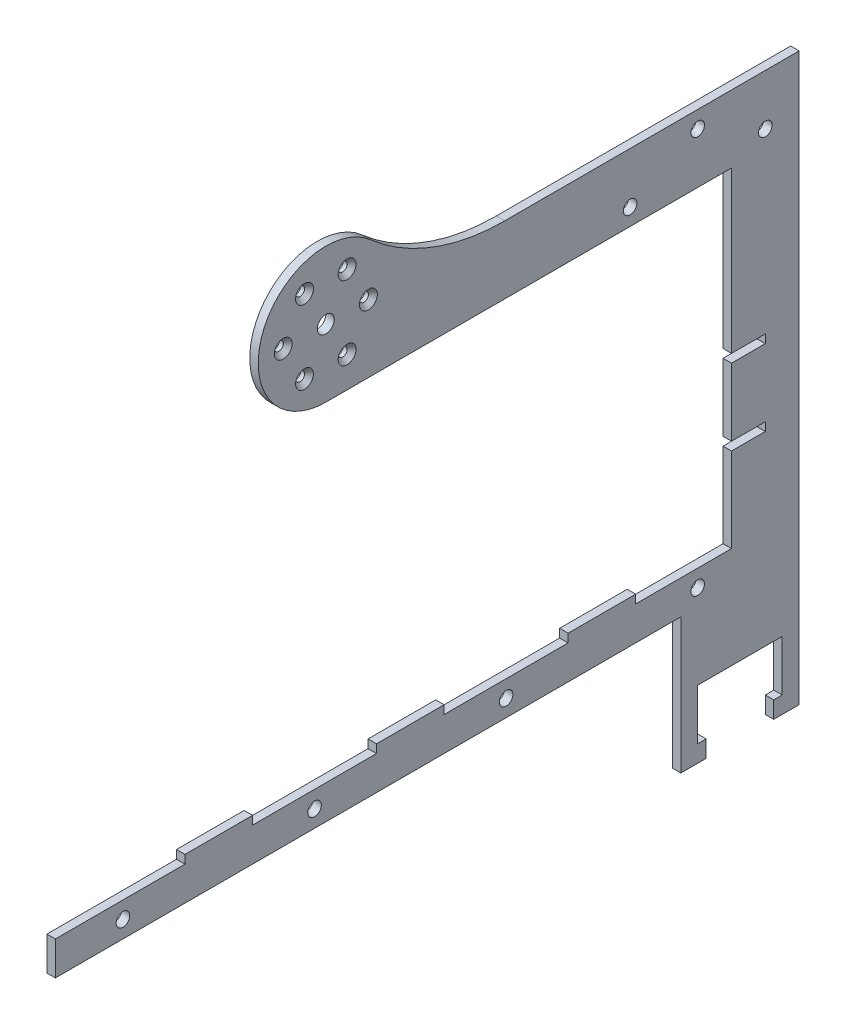
from build123d import *

# Parameters (mm, degrees)
BASE_FLANGE1_DEPTH           = 3.175
SKETCH8_W                    = 12.7
SKETCH8_H                    = 3.175
CUT_EXTRUDE2_DEPTH           = 309.926847379
SKETCH11_R                   = 3.175
CUT_EXTRUDE4_DEPTH           = 309.926847379
SKETCH21_R                   = 2.5527
CUT_EXTRUDE5_DEPTH           = 309.926847379
SKETCH23_W                   = 25.4
SKETCH23_H                   = 3.175
TAB1_DEPTH                   = 3.175
CSK_FOR_M3_SFHCS1_AT_2_COUNT = 2
CSK_FOR_M3_SFHCS1_AT_2_PITCH = 16
CSK_FOR_M3_SFHCS1_AT_3_COUNT = 2
CSK_FOR_M3_SFHCS1_AT_3_PITCH = 27.712812921
CSK_FOR_M3_SFHCS1_AT_4_COUNT = 2
CSK_FOR_M3_SFHCS1_AT_4_PITCH = 32
CSK_FOR_M3_SFHCS1_AT_5_COUNT = 2
CSK_FOR_M3_SFHCS1_AT_5_PITCH = 27.712812921
CSK_FOR_M3_SFHCS1_AT_6_COUNT = 2
CSK_FOR_M3_SFHCS1_AT_6_PITCH = 16


# Sheet-metal steps are written as plain solids
with BuildPart() as part:
    # Sketch1 → Base-Flange1 (new body)
    with BuildSketch(Plane(origin=(0, 0, 0), x_dir=(0, 0, -1), z_dir=(1, 0, 0))):
        with BuildLine():
            Line((0, -80.9625), (0, 80.9625))
            Line((0, 80.9625), (-110.597916699, 80.9625))
            ThreePointArc((-110.597916699, 80.9625), (-137.538685062, 85.883926782), (-160.999479175, 100.0125))
            ThreePointArc((-160.999479175, 100.0125), (-201.559524406, 89.942756121), (-177.8, 55.5625))
            Line((-177.8, 55.5625), (-25.4, 55.5625))
            Line((-25.4, 55.5625), (-25.4, -68.2625))
            Line((-25.4, -68.2625), (-279.4, -68.2625))
            Line((-279.4, -68.2625), (-279.4, -80.9625))
            Line((-279.4, -80.9625), (-44.45, -80.9625))
            Line((-44.45, -80.9625), (-44.45, -131.7625))
            Line((-44.45, -131.7625), (-34.925, -131.7625))
            Line((-34.925, -131.7625), (-34.925, -125.4125))
            Line((-34.925, -125.4125), (-38.1, -125.4125))
            Line((-38.1, -125.4125), (-38.1, -106.3625))
            Line((-38.1, -106.3625), (-6.35, -106.3625))
            Line((-6.35, -106.3625), (-6.35, -125.4125))
            Line((-6.35, -125.4125), (-9.525, -125.4125))
            Line((-9.525, -125.4125), (-9.525, -131.7625))
            Line((-9.525, -131.7625), (0, -131.7625))
            Line((0, -131.7625), (0, -80.9625))
        make_face()
    extrude(amount=-BASE_FLANGE1_DEPTH)

    # Sketch8 → Cut-Extrude2 (cut, through all)
    with BuildSketch(Plane(origin=(0, 0, 0), x_dir=(0, 0, -1), z_dir=(1, 0, 0))):
        with Locations((-19.05, -6.35)):
            Rectangle(SKETCH8_W, SKETCH8_H)
        with Locations((-19.05, -34.925)):
            Rectangle(SKETCH8_W, SKETCH8_H)
    extrude(amount=-CUT_EXTRUDE2_DEPTH, mode=Mode.SUBTRACT)

    # Sketch11 → Cut-Extrude4 (cut, through all)
    with BuildSketch(Plane(origin=(0, 0, 0), x_dir=(0, 0, -1), z_dir=(1, 0, 0))):
        with Locations((-177.8, 80.9625)):
            Circle(SKETCH11_R)
    extrude(amount=-CUT_EXTRUDE4_DEPTH, mode=Mode.SUBTRACT)

    # Sketch21 → Cut-Extrude5 (cut, through all)
    with BuildSketch(Plane(origin=(0, 0, 0), x_dir=(0, 0, -1), z_dir=(1, 0, 0))):
        with Locations((-38.1, -74.6125)):
            Circle(SKETCH21_R)
        with Locations((-110.066666667, -74.6125)):
            Circle(SKETCH21_R)
        with Locations((-182.033333333, -74.6125)):
            Circle(SKETCH21_R)
        with Locations((-254, -74.6125)):
            Circle(SKETCH21_R)
        with Locations((-12.7, 61.9125)):
            Circle(SKETCH21_R)
        with Locations((-38.1, 74.6125)):
            Circle(SKETCH21_R)
        with Locations((-63.5, 61.9125)):
            Circle(SKETCH21_R)
    extrude(amount=-CUT_EXTRUDE5_DEPTH, mode=Mode.SUBTRACT)

    # Sketch23 → Tab1 (add)
    with BuildSketch(Plane(origin=(0, 0, 0), x_dir=(0, 0, -1), z_dir=(1, 0, 0))):
        with Locations((-218.016666667, -66.675)):
            Rectangle(SKETCH23_W, SKETCH23_H)
        with Locations((-146.05, -66.675)):
            Rectangle(SKETCH23_W, SKETCH23_H)
        with Locations((-74.083333333, -66.675)):
            Rectangle(SKETCH23_W, SKETCH23_H)
    extrude(amount=-TAB1_DEPTH)

    # Sketch25 → CSK for M3 SFHCS1 (revolve, cut)
    with BuildSketch(Plane(origin=(0, 80.9625, 161.8), x_dir=(0, 0, -1), z_dir=(0, 1, 0))):
        Polygon((0, 0), (0, 3.175), (1.7, 3.175), (1.7, 1.66), (3.36, 0), align=None)
    csk_for_m3_sfhcs1 = revolve(axis=Axis((6.35, 80.9625, 161.8), (-1, 0, 0)), mode=Mode.SUBTRACT)

    # CSK for M3 SFHCS1 at 2: CSK for M3 SFHCS1 ×2
    with Locations(*[Vector(0, -0.8660254037844389, 0.4999999999999998) * (i * CSK_FOR_M3_SFHCS1_AT_2_PITCH) for i in range(1, CSK_FOR_M3_SFHCS1_AT_2_COUNT)]):
        add(csk_for_m3_sfhcs1, mode=Mode.SUBTRACT)

    # CSK for M3 SFHCS1 at 3: CSK for M3 SFHCS1 ×2
    with Locations(*[Vector(0, -0.500000000000002, 0.8660254037844376) * (i * CSK_FOR_M3_SFHCS1_AT_3_PITCH) for i in range(1, CSK_FOR_M3_SFHCS1_AT_3_COUNT)]):
        add(csk_for_m3_sfhcs1, mode=Mode.SUBTRACT)

    # CSK for M3 SFHCS1 at 4: CSK for M3 SFHCS1 ×2
    with Locations(*[(0, 0, i * CSK_FOR_M3_SFHCS1_AT_4_PITCH) for i in range(1, CSK_FOR_M3_SFHCS1_AT_4_COUNT)]):
        add(csk_for_m3_sfhcs1, mode=Mode.SUBTRACT)

    # CSK for M3 SFHCS1 at 5: CSK for M3 SFHCS1 ×2
    with Locations(*[Vector(0, 0.5000000000000007, 0.8660254037844384) * (i * CSK_FOR_M3_SFHCS1_AT_5_PITCH) for i in range(1, CSK_FOR_M3_SFHCS1_AT_5_COUNT)]):
        add(csk_for_m3_sfhcs1, mode=Mode.SUBTRACT)

    # CSK for M3 SFHCS1 at 6: CSK for M3 SFHCS1 ×2
    with Locations(*[Vector(0, 0.8660254037844379, 0.5000000000000013) * (i * CSK_FOR_M3_SFHCS1_AT_6_PITCH) for i in range(1, CSK_FOR_M3_SFHCS1_AT_6_COUNT)]):
        add(csk_for_m3_sfhcs1, mode=Mode.SUBTRACT)


solid = part.part
